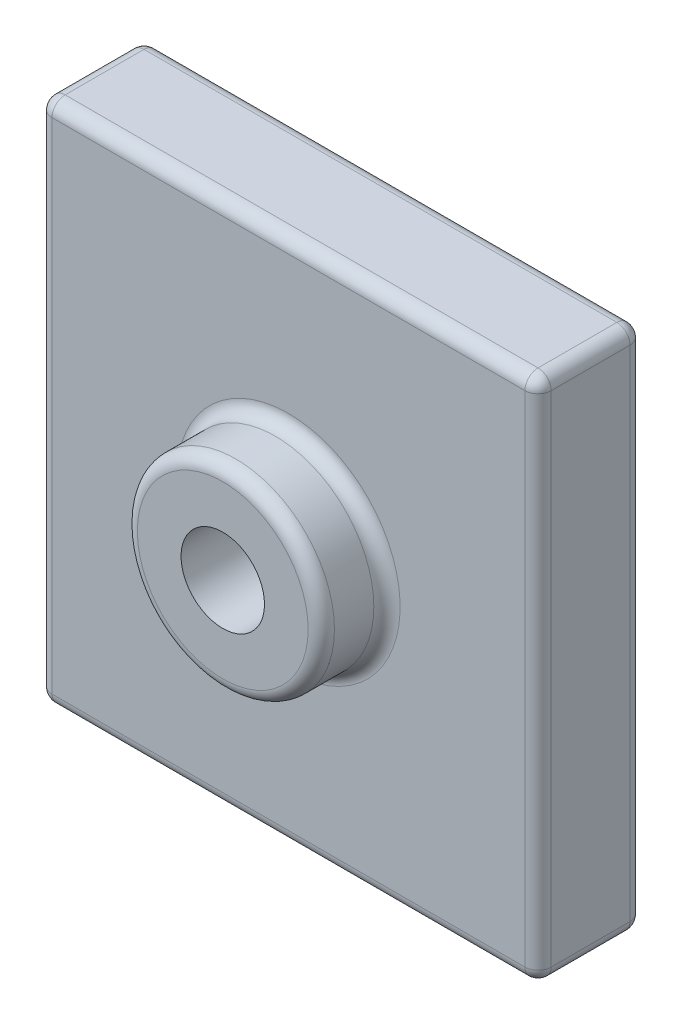
from build123d import *
from build123d.topology import SkipClean

# Parameters (mm, degrees)
SKETCH1_W           = 38
SKETCH1_H           = 40
BOSS_EXTRUDE1_DEPTH = 8
SKETCH2_R           = 7.5
SKETCH2_R_2         = 3.175
BOSS_EXTRUDE2_DEPTH = 5
FILLET1_R           = 1
CUT_EXTRUDE1_DEPTH  = 5.55625
SKETCH4_R           = 3.175
CUT_EXTRUDE2_DEPTH  = 57.683330883


with BuildPart() as part:
    # Sketch1 → Boss-Extrude1 (new body)
    with BuildSketch(Plane.XY):
        with Locations((19, 20)):
            Rectangle(SKETCH1_W, SKETCH1_H)
    extrude(amount=BOSS_EXTRUDE1_DEPTH)

    # Sketch2 → Boss-Extrude2 (add)
    with BuildSketch(Plane.XY.offset(8)):
        with Locations((19, 20)):
            Circle(SKETCH2_R)
        with Locations((19, 20)):
            Circle(SKETCH2_R_2, mode=Mode.SUBTRACT)
    extrude(amount=BOSS_EXTRUDE2_DEPTH)

    # Fillet1
    fillet1_edges = [part.edges().sort_by_distance(p)[0] for p in [
        (11.5, 20, 13),
        (19, 0, 0),
        (19, 40, 0),
        (38, 0, 4),
        (38, 40, 4),
        (38, 20, 0),
        (0, 40, 4),
        (0, 0, 4),
        (0, 20, 0),
        (11.5, 20, 8),
        (19, 40, 8),
        (38, 20, 8),
        (19, 0, 8),
        (0, 20, 8),
    ]]
    fillet(fillet1_edges, radius=FILLET1_R)

    # Sketch3 → Cut-Extrude1 (cut)
    with BuildSketch(Plane(origin=(0, 0, 0), x_dir=(-1, 0, 0), z_dir=(0, 0, -1))):
        Polygon((-17.166912895, 23.175), (-20.833087105, 23.175), (-22.666174209, 20), (-20.833087105, 16.825), (-17.166912895, 16.825), (-15.333825791, 20), align=None)
    extrude(amount=-CUT_EXTRUDE1_DEPTH, mode=Mode.SUBTRACT)

    # Sketch4 → Cut-Extrude2 (cut, through all)
    with SkipClean():  # the faces are left unmerged after this step: merging them gives an invalid solid
        with BuildSketch(Plane(origin=(0, 0, 0), x_dir=(-1, 0, 0), z_dir=(0, 0, -1))):
            with Locations((-19, 20)):
                Circle(SKETCH4_R)
        extrude(amount=-CUT_EXTRUDE2_DEPTH, mode=Mode.SUBTRACT)


solid = part.part
